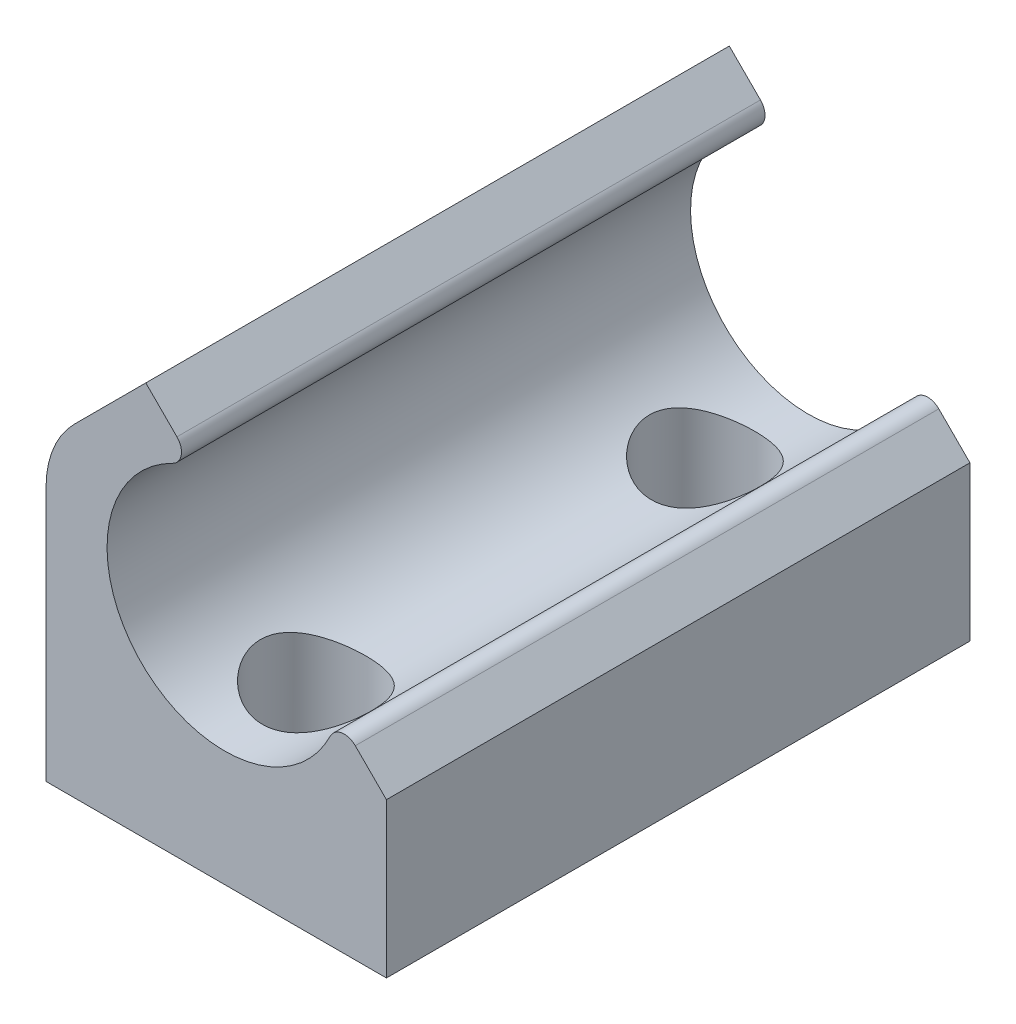
from build123d import *

# Parameters (mm, degrees)
BOSS_EXTRUDE1_DEPTH = 30
FILLET1_R           = 0.8
SKETCH3_R           = 2.85
CUT_EXTRUDE1_DEPTH  = 9
SKETCH4_R           = 1.55
CUT_EXTRUDE2_DEPTH  = 37.426390381
FILLET2_R           = 5


with BuildPart() as part:
    # Sketch1 → Boss-Extrude1 (new body)
    with BuildSketch(Plane.XY):
        with BuildLine():
            Line((0, 0), (17.5, 0))
            Line((17.5, 0), (17.5, 7.94))
            Line((17.5, 7.94), (15.025126266, 10.414873734))
            ThreePointArc((15.025126266, 10.414873734), (4.907782078, 7.719443047), (7.603212766, 17.836787234))
            Line((7.603212766, 17.836787234), (5.128339032, 20.311660968))
            Line((5.128339032, 20.311660968), (0, 15.183321936))
            Line((0, 15.183321936), (0, 0))
        make_face()
    extrude(amount=BOSS_EXTRUDE1_DEPTH)

    # Fillet1
    fillet1_edges = [part.edges().sort_by_distance(p)[0] for p in [
        (15.025126266, 10.414873734, 15),
        (7.603212766, 17.836787234, 15),
    ]]
    fillet(fillet1_edges, radius=FILLET1_R)

    # Sketch3 → Cut-Extrude1 (cut)
    with BuildSketch(Plane(origin=(0, 9.328405067, 0), x_dir=(-1, 0, 0), z_dir=(0, -1, 0))):
        with Locations((-8.875495285, -5)):
            Circle(SKETCH3_R)
        with Locations((-8.875495285, -25)):
            Circle(SKETCH3_R)
    extrude(amount=CUT_EXTRUDE1_DEPTH, mode=Mode.SUBTRACT)

    # Sketch4 → Cut-Extrude2 (cut, through all)
    with BuildSketch(Plane(origin=(0, 9.328405067, 0), x_dir=(-1, 0, 0), z_dir=(0, -1, 0))):
        with Locations((-8.875495285, -5)):
            Circle(SKETCH4_R)
        with Locations((-8.875495285, -25)):
            Circle(SKETCH4_R)
    extrude(amount=CUT_EXTRUDE2_DEPTH, mode=Mode.SUBTRACT)

    # Fillet2
    fillet2_edges = [part.edges().sort_by_distance(p)[0] for p in [
        (0, 15.183321936, 15),
    ]]
    fillet(fillet2_edges, radius=FILLET2_R)


solid = part.part
